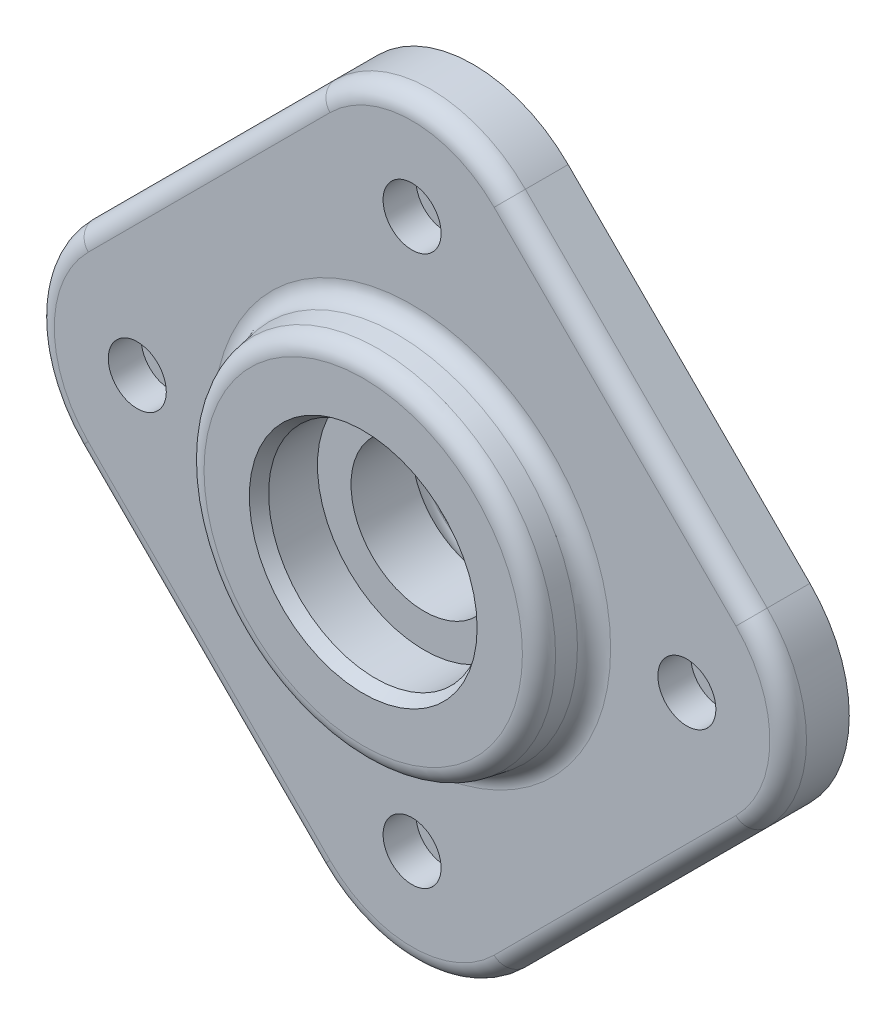
from build123d import *

# Parameters (mm, degrees)
BOSS_EXTRUDE1_DEPTH     = 10
SKETCH2_R               = 30
BOSS_EXTRUDE2_DEPTH     = 8
BOSS_EXTRUDE2_TAPER     = 10
SKETCH4_R               = 17.5
BOSS_EXTRUDE3_DEPTH     = 5
CUT_EXTRUDE1_DEPTH      = 91.097848019
CUT_EXTRUDE1_DEPTH_BACK = 91.097848019
SKETCH3_R               = 12
SKETCH3_3_R             = 17.5
SKETCH3_3_R_2           = 12
CUT_EXTRUDE2_DEPTH      = 10
SKETCH5_R               = 14
CUT_EXTRUDE3_DEPTH      = 3
CUT_EXTRUDE4_DEPTH      = 89.394695642
CUT_EXTRUDE4_DEPTH_BACK = 89.394695642
SKETCH6_R               = 2.75
SKETCH6_3_R             = 4.75
SKETCH6_3_R_2           = 2.75
CUT_EXTRUDE5_DEPTH      = 5.4
FILLET1_R               = 3
FILLET2_R               = 3
FILLET3_R               = 3
FILLET4_R               = 2


with BuildPart() as part:
    # Sketch1 → Boss-Extrude1 (new body)
    with BuildSketch(Plane.XY):
        with BuildLine():
            Line((-15.556349186, 55.154328933), (-55.154328933, 15.556349186))
            ThreePointArc((-55.154328933, 15.556349186), (-61.597979746, 0), (-55.154328933, -15.556349186))
            Line((-55.154328933, -15.556349186), (-15.556349186, -55.154328933))
            ThreePointArc((-15.556349186, -55.154328933), (0, -61.597979746), (15.556349186, -55.154328933))
            Line((15.556349186, -55.154328933), (55.154328933, -15.556349186))
            ThreePointArc((55.154328933, -15.556349186), (61.597979746, 0), (55.154328933, 15.556349186))
            Line((55.154328933, 15.556349186), (15.556349186, 55.154328933))
            ThreePointArc((15.556349186, 55.154328933), (0, 61.597979746), (-15.556349186, 55.154328933))
        make_face()
    extrude(amount=BOSS_EXTRUDE1_DEPTH)

    # Sketch2 → Boss-Extrude2 (add)
    with BuildSketch(Plane.XY.offset(10)):
        Circle(SKETCH2_R)
    extrude(amount=BOSS_EXTRUDE2_DEPTH, taper=BOSS_EXTRUDE2_TAPER)

    # Sketch4 → Boss-Extrude3 (add)
    with BuildSketch(Plane(origin=(0, 0, 0), x_dir=(-1, 0, 0), z_dir=(0, 0, -1))):
        Circle(SKETCH4_R)
    extrude(amount=BOSS_EXTRUDE3_DEPTH)

    # Sketch3 → Cut-Extrude1 (cut, two sides: drawn at the far end of the back side and taken through both)
    with BuildSketch(Plane.XY.offset(18).offset(-CUT_EXTRUDE1_DEPTH_BACK)):
        Circle(SKETCH3_R)
    extrude(amount=CUT_EXTRUDE1_DEPTH + CUT_EXTRUDE1_DEPTH_BACK, mode=Mode.SUBTRACT)

    # Sketch3<3> → Cut-Extrude2 (cut)
    with BuildSketch(Plane.XY.offset(18)):
        with Locations(Location((0, 0, 0), (0, 0, 180))):
            Circle(SKETCH3_3_R)
        Circle(SKETCH3_3_R_2, mode=Mode.SUBTRACT)
    extrude(amount=-CUT_EXTRUDE2_DEPTH, mode=Mode.SUBTRACT)

    # Sketch5 → Cut-Extrude3 (cut)
    with BuildSketch(Plane(origin=(0, 0, -5), x_dir=(-1, 0, 0), z_dir=(0, 0, -1))):
        Circle(SKETCH5_R)
    extrude(amount=-CUT_EXTRUDE3_DEPTH, mode=Mode.SUBTRACT)

    # Sketch6 → Cut-Extrude4 (cut, two sides: drawn at the far end of the back side and taken through both)
    with BuildSketch(Plane.XY.offset(10).offset(-CUT_EXTRUDE4_DEPTH_BACK)):
        with Locations((0, 45)):
            Circle(SKETCH6_R)
        with Locations((45, 0)):
            Circle(SKETCH6_R)
        with Locations((0, -45)):
            Circle(SKETCH6_R)
        with Locations((-45, 0)):
            Circle(SKETCH6_R)
    extrude(amount=CUT_EXTRUDE4_DEPTH + CUT_EXTRUDE4_DEPTH_BACK, mode=Mode.SUBTRACT)

    # Sketch6<3> → Cut-Extrude5 (cut)
    # profile 1 of 4: a face of its own
    with BuildSketch(Plane.XY.offset(10)):
        with Locations((-45, 0)):
            Circle(SKETCH6_3_R)
        with Locations((-45, 0)):
            Circle(SKETCH6_3_R_2, mode=Mode.SUBTRACT)
    # profile 2 of 4: a face of its own
    with BuildSketch(Plane.XY.offset(10)):
        with Locations((0, -45)):
            Circle(SKETCH6_3_R)
        with Locations((0, -45)):
            Circle(SKETCH6_3_R_2, mode=Mode.SUBTRACT)
    # profile 3 of 4: a face of its own
    with BuildSketch(Plane.XY.offset(10)):
        with Locations((45, 0)):
            Circle(SKETCH6_3_R)
        with Locations((45, 0)):
            Circle(SKETCH6_3_R_2, mode=Mode.SUBTRACT)
    # profile 4 of 4: a face of its own
    with BuildSketch(Plane.XY.offset(10)):
        with Locations((0, 45)):
            Circle(SKETCH6_3_R)
        with Locations((0, 45)):
            Circle(SKETCH6_3_R_2, mode=Mode.SUBTRACT)
    extrude(amount=-CUT_EXTRUDE5_DEPTH, mode=Mode.SUBTRACT)

    # Sketch7 → Cut-Revolve1 (revolve, cut)
    with BuildSketch(Plane(origin=(0, 0, 0), x_dir=(0, 0, -1), z_dir=(1, 0, 0)), mode=Mode.PRIVATE) as cut_revolve1_sk:
        Polygon((-18, 17.5), (-16, 17.5), (-18, 18.654700538), align=None)
    revolve(cut_revolve1_sk.sketch.rotate(Axis((0, 0, 32.778670792), (0, 0, -1)), 90), axis=Axis((0, 0, 32.778670792), (0, 0, -1)), mode=Mode.SUBTRACT)

    # Fillet1
    fillet1_edges = [part.edges().sort_by_distance(p)[0] for p in [
        (-30, 0, 10),
        (-28.589384154, 0, 18),
    ]]
    fillet(fillet1_edges, radius=FILLET1_R)

    # Fillet2
    fillet2_edges = [part.edges().sort_by_distance(p)[0] for p in [
        (61.597979746, 0, 10),
        (35.355339059, 35.355339059, 10),
        (0, 61.597979746, 10),
        (-35.355339059, 35.355339059, 10),
        (-61.597979746, 0, 10),
        (-35.355339059, -35.355339059, 10),
        (0, -61.597979746, 10),
        (35.355339059, -35.355339059, 10),
    ]]
    fillet(fillet2_edges, radius=FILLET2_R)

    # Fillet3
    # the kernel refuses this fillet: 3 mm, written as the material it adds along each edge
    with BuildSketch(Plane(origin=(0, 0, -2), x_dir=(-1, 0, 0), z_dir=(0, -1, 0))) as fillet3_piece_1:
        with BuildLine():
            CenterArc((11, 2.828427125), FILLET3_R, 289.471220634, 70.528779366)
            Line((12, 0), (12.02, -0.056568542))
            ThreePointArc((12.02, -0.056568542), (13, -0.06), (14, -0.06))
            Line((14, -0.06), (14.06, 0))
            Line((14.06, 0), (14.06, 2.828427125))
            Line((14.06, 2.828427125), (14, 2.828427125))
        make_face()
    revolve(axis=Axis((0, 0, -2), (0, 0, -1)))

    # Fillet4
    fillet4_edges = [part.edges().sort_by_distance(p)[0] for p in [
        (17.5, 0, -5),
    ]]
    fillet(fillet4_edges, radius=FILLET4_R)


solid = part.part
